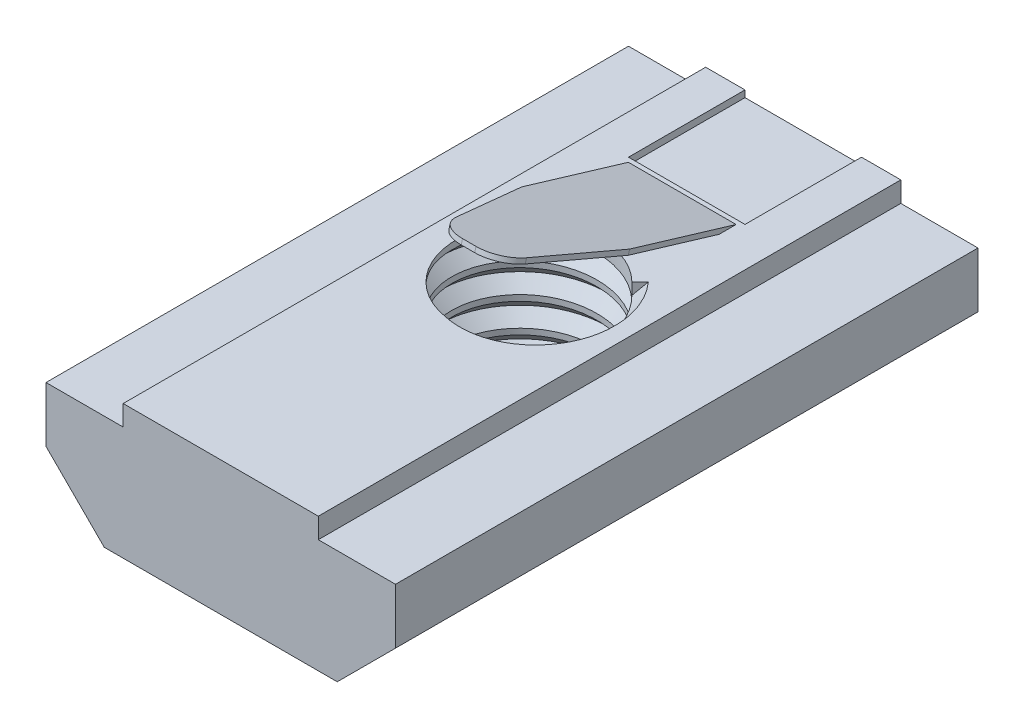
from build123d import *

# Parameters (mm, degrees)
EXTRUDE_1_DEPTH      = 20
CHAMFER_1_SIZE       = 2
SKETCH_2_R           = 2.5
CUT_EXTRUDE_1_DEPTH  = 22.381300241
SWEEP_1_PITCH        = 1
SKETCH_6_W           = 4
SKETCH_6_H           = 0.46098281
CUT_EXTRUDE_2_DEPTH  = 4
EXTRUDE_2_DEPTH      = 1.85
EXTRUDE_2_DEPTH_BACK = 1.85
CUT_EXTRUDE_3_DEPTH  = 1.85
FILLET_1_R           = 1


with BuildPart() as part:
    # 草图1 → 凸台-拉伸1 (new body)
    with BuildSketch(Plane.XY):
        Polygon((-6, 0), (6, 0), (6, 3.9), (3.35, 3.9), (3.35, 4.6), (-3.35, 4.6), (-3.35, 3.9), (-6, 3.9), align=None)
    extrude(amount=EXTRUDE_1_DEPTH)

    # 倒角1
    chamfer_1_edges = [part.edges().sort_by_distance(p)[0] for p in [
        (6, 0, 10),
        (-6, 0, 10),
    ]]
    chamfer(chamfer_1_edges, length=CHAMFER_1_SIZE)

    # 草图2 → 切除-拉伸1 (cut, through all)
    with BuildSketch(Plane(origin=(0, 4.6, 0), x_dir=(1, 0, 0), z_dir=(0, 1, 0))):
        with Locations(Location((0, -9.419001614, 0), (0, 0, 270))):
            Circle(SKETCH_2_R)
    extrude(amount=-CUT_EXTRUDE_1_DEPTH, mode=Mode.SUBTRACT)

    # 切除-扫描1: arcs per turn and ends read off the stored shape
    # 切除-扫描1: the profile of 草图5 profile screwed along a right-hand helix through 5 turns, 8 arcs to a turn; built about Z, then put on its axis
    sweep_1_z = Axis((0, 0, 0), (0, 0, 1))
    sweep_1_corners = [(2.4997, 0, -0.4003), (2.4997, 0, 0.4003), (2.9, 0, 0)]
    with BuildLine(mode=Mode.PRIVATE) as sweep_1_profile:
        Line(sweep_1_corners[0], sweep_1_corners[1])
        Line(sweep_1_corners[1], sweep_1_corners[2])
        Line(sweep_1_corners[2], sweep_1_corners[0])
    sweep_1_cap = Face(sweep_1_profile.wire())
    sweep_1_turn_angles = [0, 22.5, 45, 67.5, 90, 112.5, 135, 157.5, 180, 202.5, 225, 247.5, 270, 292.5, 315, 337.5, 360]
    sweep_1_turn_weights = [1, 0.9238795325112867, 1, 0.9238795325112867, 1, 0.9238795325112867, 1, 0.9238795325112867, 1, 0.9238795325112867, 1, 0.9238795325112867, 1, 0.9238795325112867, 1, 0.9238795325112867, 1]
    sweep_1_turn_rails = [Edge.make_bspline([Vector(p[0], p[1], 0).rotate(sweep_1_z, sweep_1_turn_angles[k]) / sweep_1_turn_weights[k] + Vector(0, 0, p[2] + SWEEP_1_PITCH * sweep_1_turn_angles[k] / 360) for k in range(17)], [0, 0, 0, 1, 1, 2, 2, 3, 3, 4, 4, 5, 5, 6, 6, 7, 7, 8, 8, 8], 2, sweep_1_turn_weights) for p in sweep_1_corners]
    sweep_1_turn_sides = [Face.make_surface_from_curves(sweep_1_turn_rails[p[0]], sweep_1_turn_rails[p[1]]) for p in [(0, 1), (1, 2), (2, 0)]]
    sweep_1 = Plane(origin=(0, 4.6, 9.419001614), x_dir=(0.7071067811865438, 0, -0.7071067811865513), z_dir=(0, -1, 0)) * Solid(Shell([*[p.moved(Location((0, 0, SWEEP_1_PITCH * i))) for i in range(5) for p in sweep_1_turn_sides], sweep_1_cap, sweep_1_cap.rotate(sweep_1_z, 1800).moved(Location((0, 0, SWEEP_1_PITCH * 1800 / 360)))]))
    add(sweep_1, mode=Mode.SUBTRACT)

    # 草图6 → 切除-拉伸2 (cut)
    with BuildSketch(Plane(origin=(0, 0, 0), x_dir=(-1, 0, 0), z_dir=(0, 0, -1))):
        with Locations((0, 4.6)):
            Rectangle(SKETCH_6_W, SKETCH_6_H)
    extrude(amount=-CUT_EXTRUDE_2_DEPTH, mode=Mode.SUBTRACT)

    # 草图7 → 凸台-拉伸2 (add, two sides: drawn at the far end of the back side and taken through both)
    with BuildSketch(Plane(origin=(0, 0, 0), x_dir=(0, 0, -1), z_dir=(1, 0, 0)).offset(-EXTRUDE_2_DEPTH_BACK)):
        Polygon((-4.154281608, 4.6), (-11.466055335, 6.795870295), (-11.514546749, 6.63440436), (-4.740419706, 4.6), align=None)
    extrude(amount=EXTRUDE_2_DEPTH + EXTRUDE_2_DEPTH_BACK)

    # 草图8 → 切除-拉伸3 (cut)
    with BuildSketch(Plane(origin=(0, 3.075042872, -0.923496206), x_dir=(1, 0, 0), z_dir=(0, 0.9577419497796025, -0.2876288539635158))):
        Polygon((-1.85, -9.119016537), (-1.041199164, -12.936210577), (-1.85, -12.936210577), align=None)
    cut_extrude_3 = extrude(amount=-CUT_EXTRUDE_3_DEPTH, mode=Mode.SUBTRACT)

    # 镜向1: 切除-拉伸3 across plane
    add(cut_extrude_3.mirror(Plane(origin=(0, 0, 0), x_dir=(0, 0, 1), z_dir=(1, 0, 0))), mode=Mode.SUBTRACT)

    # 圆角1
    fillet_1_edges = [part.edges().sort_by_distance(p)[0] for p in [
        (-1.041199164, 6.715137327, 11.490301042),
        (1.041199164, 6.715137327, 11.490301042),
    ]]
    fillet(fillet_1_edges, radius=FILLET_1_R)


solid = part.part
